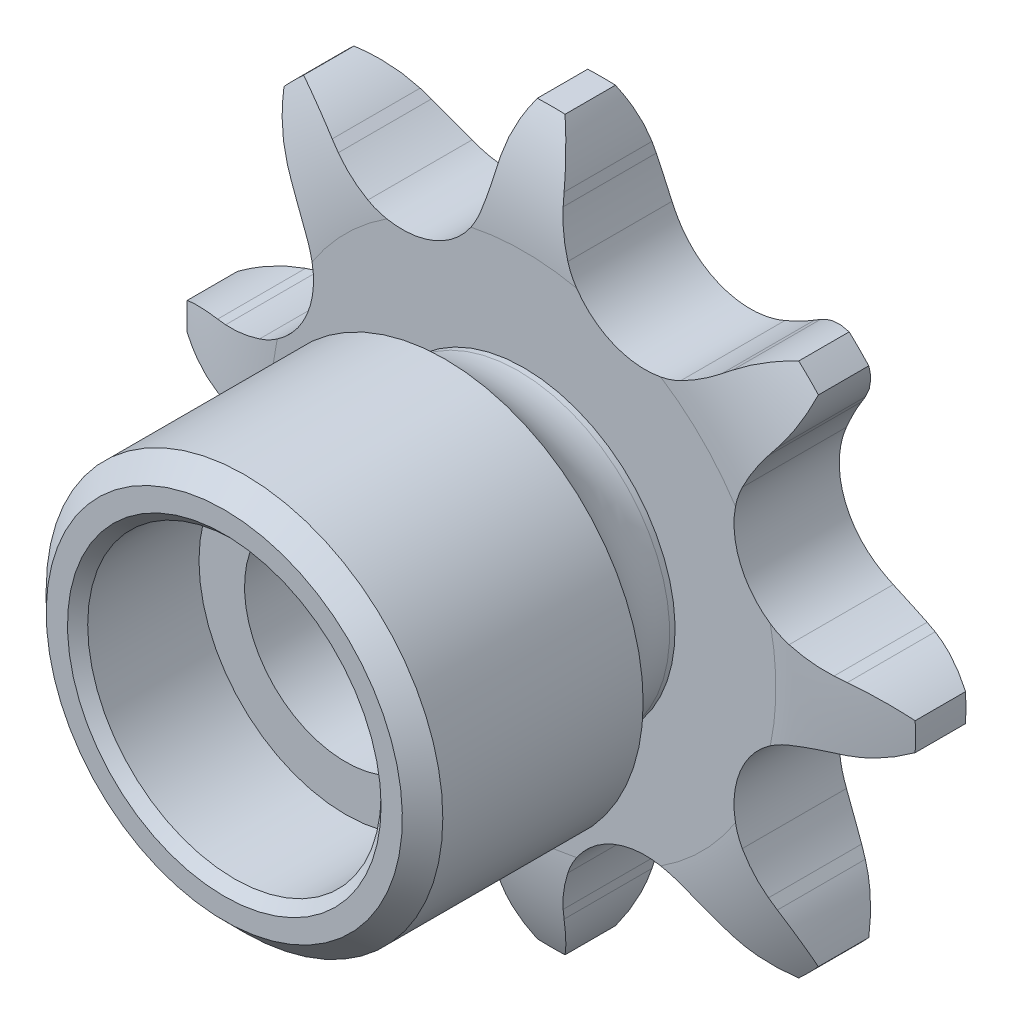
from build123d import *

# Parameters (mm, degrees)
CUT_EXTRUDE1_DEPTH      = 13.854131678
CIRPATTERN1_COUNT       = 8
BOSS_EXTRUDE1_START     = 1.3
SKETCH2_R               = 4.9
BOSS_EXTRUDE1_DEPTH     = 7.4
CUT_EXTRUDE2_DEPTH      = 16.467019907
CUT_EXTRUDE2_DEPTH_BACK = 16.467019907
SKETCH3_R               = 2.5
SKETCH4_W               = 1.95
SKETCH4_H               = 5.303262898
CUT_EXTRUDE3_DEPTH      = 16.467019907
CUT_EXTRUDE3_DEPTH_BACK = 16.467019907
SKETCH5_OUTSIDE_W       = 25.578
SKETCH5_OUTSIDE_H       = 25.578
SKETCH5_OUTSIDE_R       = 9
SKETCH6_R               = 3.625
CUT_EXTRUDE4_DEPTH      = 3
CUT_EXTRUDE5_START      = -1.5
SKETCH7_R               = 3.625
CUT_EXTRUDE5_DEPTH      = 1.5
CHAMFER1_SIZE           = 0.25
FILLET3_R               = 2


with BuildPart() as part:
    # Sketch1 → Revolve1 (revolve)
    with BuildSketch(Plane(origin=(0, 0, 0), x_dir=(0, 0, -1), z_dir=(1, 0, 0))):
        with BuildLine():
            Line((1.3, 0), (-1.3, 0))
            Line((-1.3, 0), (-1.3, 6.230168465))
            ThreePointArc((-1.3, 6.230168465), (-1.122370651, 7.67930614), (-0.6, 9.042640687))
            Line((-0.6, 9.042640687), (0.6, 9.042640687))
            ThreePointArc((0.6, 9.042640687), (1.122370651, 7.67930614), (1.3, 6.230168465))
            Line((1.3, 6.230168465), (1.3, 0))
        make_face()
    revolve(axis=Axis((0, 0, -1.3), (0, 0, 1)))

    # Sketch0 → Cut-Extrude1 (cut, symmetric)
    with BuildSketch(Plane.XY):
        with BuildLine():
            Line((4.947126229, -6.053047715), (4.732377345, -5.897023517))
            ThreePointArc((4.732377345, -5.897023517), (4.311233645, -5.620909609), (3.865564462, -5.386431708))
            ThreePointArc((3.865564462, -5.386431708), (2.216226062, -5.350443017), (1.075415543, -6.542149232))
            ThreePointArc((1.075415543, -6.542149232), (0.926080755, -7.023085846), (0.823529206, -7.51612143))
            Line((0.823529206, -7.51612143), (0.782004582, -7.77829759))
            ThreePointArc((0.782004582, -7.77829759), (-0.855606698, -10.189159874), (-3.756934176, -10.465432431))
            ThreePointArc((-3.756934176, -10.465432431), (4.255189061, -10.272935141), (10.056731872, -4.743624608))
            ThreePointArc((10.056731872, -4.743624608), (7.80982934, -6.599818743), (4.947126229, -6.053047715))
        make_face()
    cut_extrude1 = extrude(amount=CUT_EXTRUDE1_DEPTH, both=True, mode=Mode.SUBTRACT)

    # CirPattern1: Cut-Extrude1 ×8 about axis
    cirpattern1_axis = Axis((0, 0, 0), (0, 0, 1))
    for i in range(1, CIRPATTERN1_COUNT):
        add(cut_extrude1.rotate(cirpattern1_axis, i * 360 / CIRPATTERN1_COUNT), mode=Mode.SUBTRACT)

    # Sketch2 → Boss-Extrude1 (add)
    with BuildSketch(Plane.XY.offset(BOSS_EXTRUDE1_START)):
        with Locations(Location((0, 0, 0), (0, 0, 270))):
            Circle(SKETCH2_R)
    extrude(amount=BOSS_EXTRUDE1_DEPTH)

    # Sketch3 → Cut-Extrude2 (cut, two sides: drawn at the far end of the back side and taken through both)
    with BuildSketch(Plane.XY.offset(-CUT_EXTRUDE2_DEPTH_BACK)):
        Circle(SKETCH3_R)
    extrude(amount=CUT_EXTRUDE2_DEPTH + CUT_EXTRUDE2_DEPTH_BACK, mode=Mode.SUBTRACT)

    # Sketch4 → Cut-Revolve1 (revolve, cut)
    with BuildSketch(Plane(origin=(0, 0, 0), x_dir=(0, 0, -1), z_dir=(1, 0, 0))):
        Polygon((-8.7, 4.9), (-8.7, 4.4), (-8.2, 4.9), align=None)
        with Locations((-2.275, 6.391009238)):
            Rectangle(SKETCH4_W, SKETCH4_H)
    revolve(axis=Axis((0, 0, -1.3), (0, 0, 1)), mode=Mode.SUBTRACT)

    # Sketch5 outside → Cut-Extrude3 (cut, two sides: drawn at the far end of the back side and taken through both)
    with BuildSketch(Plane.XY.offset(-CUT_EXTRUDE3_DEPTH_BACK)):
        Rectangle(SKETCH5_OUTSIDE_W, SKETCH5_OUTSIDE_H)
        Circle(SKETCH5_OUTSIDE_R, mode=Mode.SUBTRACT)
    extrude(amount=CUT_EXTRUDE3_DEPTH + CUT_EXTRUDE3_DEPTH_BACK, mode=Mode.SUBTRACT)

    # Sketch6 → Cut-Extrude4 (cut)
    with BuildSketch(Plane.XY.offset(8.7)):
        Circle(SKETCH6_R)
    extrude(amount=-CUT_EXTRUDE4_DEPTH, mode=Mode.SUBTRACT)

    # Sketch7 → Cut-Extrude5 (cut)
    with BuildSketch(Plane(origin=(0, 0, -1.3), x_dir=(-1, 0, 0), z_dir=(0, 0, -1)).offset(CUT_EXTRUDE5_START)):
        with Locations(Location((0, 0, 0), (0, 0, 180))):
            Circle(SKETCH7_R)
    extrude(amount=CUT_EXTRUDE5_DEPTH, mode=Mode.SUBTRACT)

    # Chamfer1
    chamfer1_edges = [part.edges().sort_by_distance(p)[0] for p in [
        (-3.625, 0, 8.7),
    ]]
    chamfer(chamfer1_edges, length=CHAMFER1_SIZE)

    # Fillet3
    # the kernel refuses this fillet: 2 mm, written as the material it adds along each edge
    with BuildSketch(Plane(origin=(0, 0, 3.25), x_dir=(0, 1, 0), z_dir=(1, 0, 0))) as fillet3_piece_1:
        with BuildLine():
            CenterArc((5.739377789, -1.815336037), FILLET3_R, 114.814947668, 65.185052332)
            Line((3.739377789, -1.815336037), (3.699377789, -1.815336037))
            Line((3.699377789, -1.815336037), (3.699377789, 0))
            Line((3.699377789, 0), (3.739377789, 0.04))
            ThreePointArc((3.739377789, 0.04), (4.319688895, 0.04), (4.883212444, 0.036306721))
            Line((4.883212444, 0.036306721), (4.9, 0))
        make_face()
    revolve(axis=Axis((0, 0, 3.25), (0, 0, 1)))


solid = part.part
